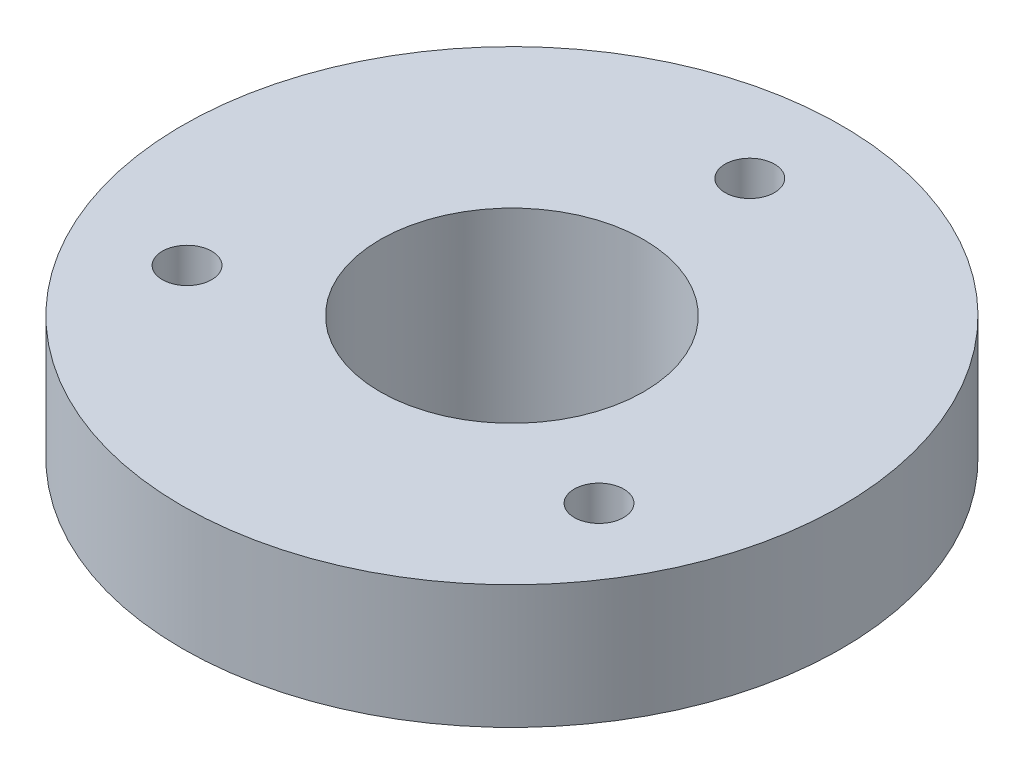
from build123d import *

# Parameters (mm, degrees)
ESQUISSE1_R        = 16
ESQUISSE1_R_2      = 6.4
ESQUISSE1_R_3      = 1.2
BOSS_EXTRU_1_DEPTH = 6
BOSS_EXTRU_2_START = 4
ESQUISSE2_R        = 8
ESQUISSE2_R_2      = 6.4
BOSS_EXTRU_2_DEPTH = 4
CHANFREIN1_SIZE    = 0.5


with BuildPart() as part:
    # Esquisse1 → Boss.-Extru.1 (new body)
    with BuildSketch(Plane(origin=(0, 0, 0), x_dir=(1, 0, 0), z_dir=(0, 1, 0))):
        Circle(ESQUISSE1_R)
        Circle(ESQUISSE1_R_2, mode=Mode.SUBTRACT)
        with Locations((0, 11.547005384)):
            Circle(ESQUISSE1_R_3, mode=Mode.SUBTRACT)
        with Locations((10, -5.773502692)):
            Circle(ESQUISSE1_R_3, mode=Mode.SUBTRACT)
        with Locations((-10, -5.773502692)):
            Circle(ESQUISSE1_R_3, mode=Mode.SUBTRACT)
    extrude(amount=BOSS_EXTRU_1_DEPTH)

    # Esquisse2 → Boss.-Extru.2 (add)
    with BuildSketch(Plane.XZ.offset(BOSS_EXTRU_2_START)):
        Circle(ESQUISSE2_R)
        Circle(ESQUISSE2_R_2, mode=Mode.SUBTRACT)
    extrude(amount=-BOSS_EXTRU_2_DEPTH)

    # Chanfrein1
    chanfrein1_edges = [part.edges().sort_by_distance(p)[0] for p in [
        (-6.4, -4, 0),
        (-8, 0, 0),
    ]]
    chamfer(chanfrein1_edges, length=CHANFREIN1_SIZE)


solid = part.part
